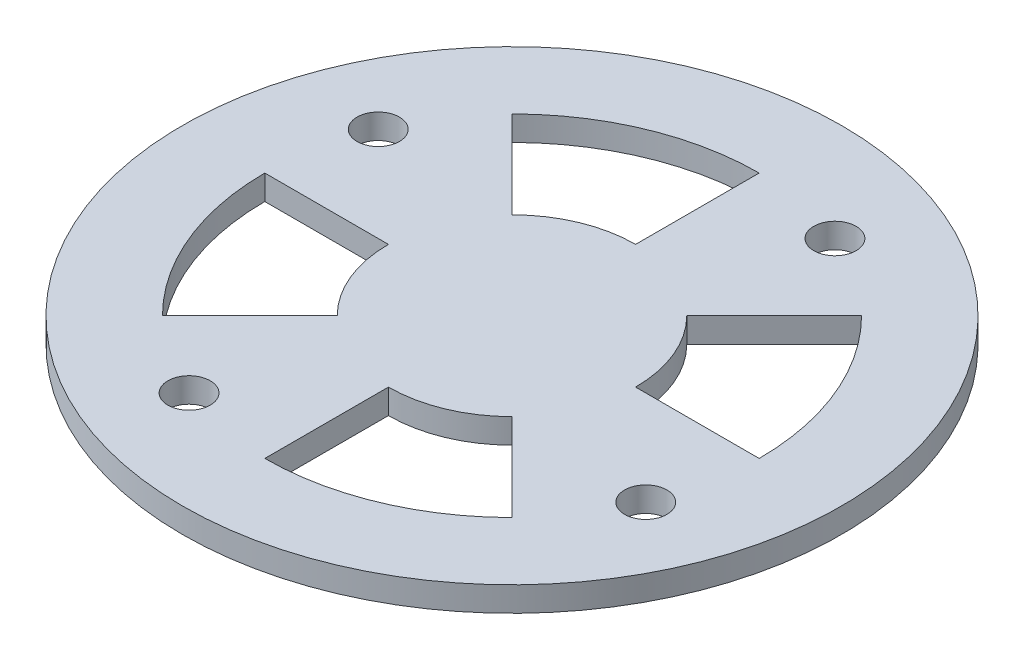
from build123d import *

# Parameters (mm, degrees)
SKETCH1_R           = 50.8
BOSS_EXTRUDE1_DEPTH = 3.81
CUT_EXTRUDE1_DEPTH  = 72.943005914
SKETCH3_R           = 3.2639
CUT_EXTRUDE2_DEPTH  = 72.943005914


with BuildPart() as part:
    # Sketch1 → Boss-Extrude1 (new body)
    with BuildSketch(Plane(origin=(0, 0, 0), x_dir=(1, 0, 0), z_dir=(0, 1, 0))):
        Circle(SKETCH1_R)
    extrude(amount=BOSS_EXTRUDE1_DEPTH)

    # Sketch2 → Cut-Extrude1 (cut, through all)
    with BuildSketch(Plane(origin=(0, 3.81, 0), x_dir=(1, 0, 0), z_dir=(0, 1, 0))):
        with BuildLine():
            ThreePointArc((-13.470384182, 13.470384182), (-7.290119387, 17.599905094), (0, 19.05))
            Line((0, 19.05), (0, 38.1))
            ThreePointArc((0, 38.1), (-14.580238773, 35.199810189), (-26.940768363, 26.940768363))
            Line((-26.940768363, 26.940768363), (-13.470384182, 13.470384182))
        make_face()
        with BuildLine():
            Line((26.940768363, 26.940768363), (13.470384182, 13.470384182))
            ThreePointArc((13.470384182, 13.470384182), (17.599905094, 7.290119387), (19.05, 0))
            Line((19.05, 0), (38.1, 0))
            ThreePointArc((38.1, 0), (35.199810189, 14.580238773), (26.940768363, 26.940768363))
        make_face()
        with BuildLine():
            Line((26.940768363, -26.940768363), (13.470384182, -13.470384182))
            ThreePointArc((13.470384182, -13.470384182), (7.290119387, -17.599905094), (0, -19.05))
            Line((0, -19.05), (0, -38.1))
            ThreePointArc((0, -38.1), (14.580238773, -35.199810189), (26.940768363, -26.940768363))
        make_face()
        with BuildLine():
            Line((-26.940768363, -26.940768363), (-13.470384182, -13.470384182))
            ThreePointArc((-13.470384182, -13.470384182), (-17.599905094, -7.290119387), (-19.05, 0))
            Line((-19.05, 0), (-38.1, 0))
            ThreePointArc((-38.1, 0), (-35.199810189, -14.580238773), (-26.940768363, -26.940768363))
        make_face()
    extrude(amount=-CUT_EXTRUDE1_DEPTH, mode=Mode.SUBTRACT)

    # Sketch3 → Cut-Extrude2 (cut, through all)
    with BuildSketch(Plane(origin=(0, 3.81, 0), x_dir=(1, 0, 0), z_dir=(0, 1, 0))):
        with Locations((14.580238773, 35.199810189)):
            Circle(SKETCH3_R)
        with Locations((35.199810189, -14.580238773)):
            Circle(SKETCH3_R)
        with Locations((-14.580238773, -35.199810189)):
            Circle(SKETCH3_R)
        with Locations((-35.199810189, 14.580238773)):
            Circle(SKETCH3_R)
    extrude(amount=-CUT_EXTRUDE2_DEPTH, mode=Mode.SUBTRACT)


solid = part.part
